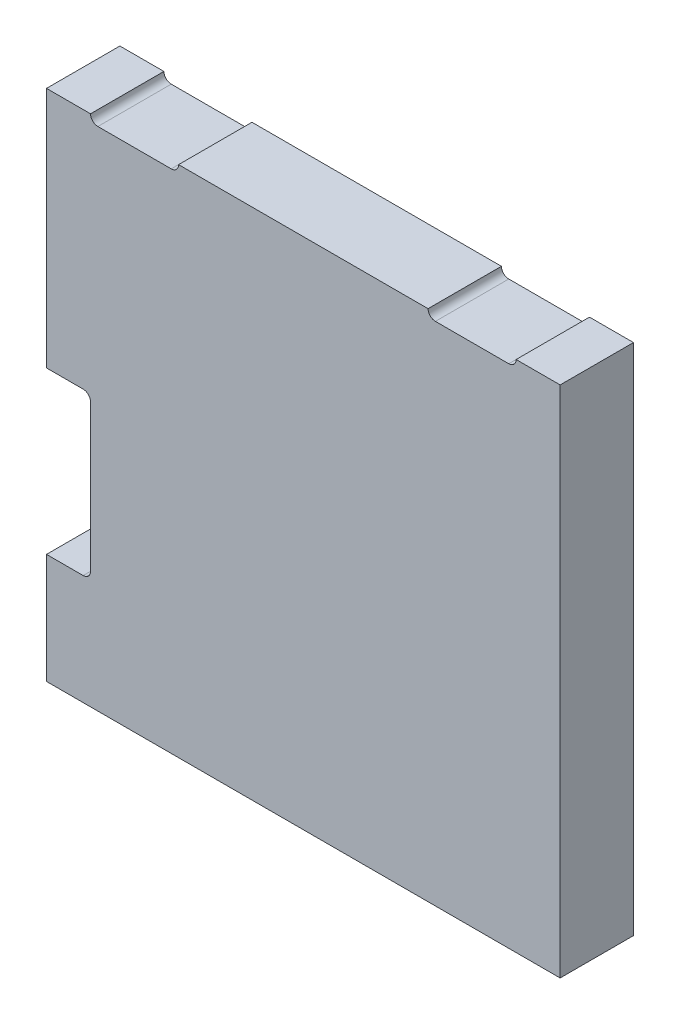
from build123d import *

# Parameters (mm, degrees)
EXTRUDE_1_DEPTH = 10
FILLET_1_R      = 1


with BuildPart() as part:
    # 草图4 → 凸台-拉伸1 (new body)
    with BuildSketch(Plane.XY):
        Polygon((-29, 35), (-35, 35), (-35, 2), (-29, 2), (-29, -20), (-35, -20), (-35, -35), (35, -35), (35, 35), (29, 35), (29, 34), (17, 34), (17, 35), (-17, 35), (-17, 34), (-29, 34), align=None)
    extrude(amount=EXTRUDE_1_DEPTH)

    # 圆角1
    fillet_1_edges = [part.edges().sort_by_distance(p)[0] for p in [
        (-29, -20, 5),
        (-29, 2, 5),
        (29, 34, 5),
        (17, 34, 5),
        (-17, 34, 5),
        (-29, 34, 5),
    ]]
    fillet(fillet_1_edges, radius=FILLET_1_R - 0.0001)  # a hair under: the kernel refuses the full size


solid = part.part
